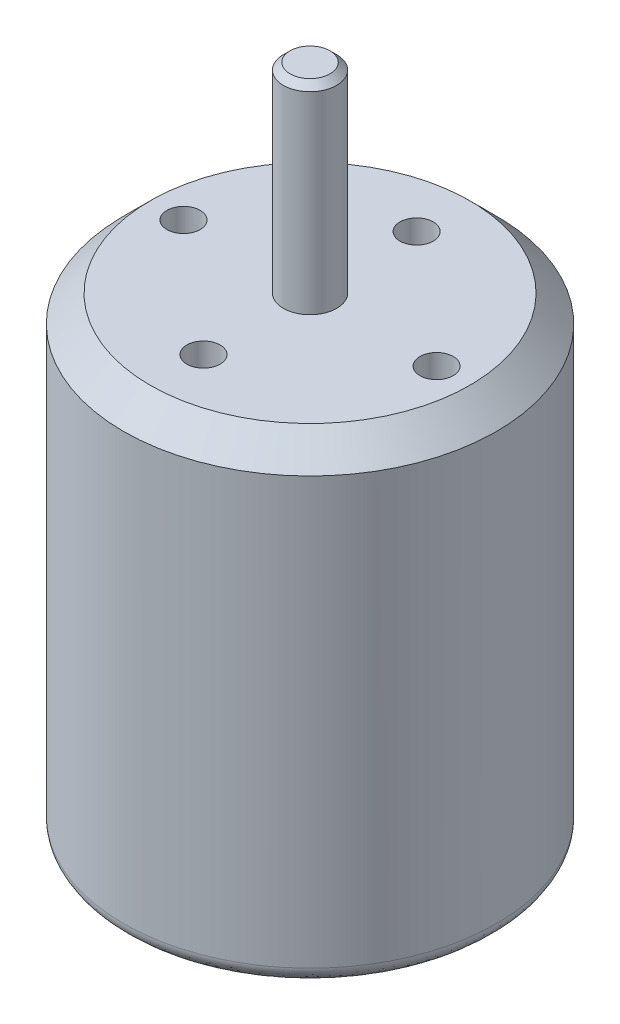
from build123d import *

# Parameters (mm, degrees)
SKETCH1_R                    = 14
BOSS_EXTRUDE1_DEPTH          = 36
SKETCH1_3_R                  = 2
BOSS_EXTRUDE2_DEPTH          = 15
BOSS_EXTRUDE3_START          = -38
SKETCH1_4_R                  = 2
BOSS_EXTRUDE3_DEPTH          = 2
CHAMFER1_SIZE                = 0.5
CHAMFER2_SIZE                = 2
FILLET1_SIZE                 = 2
FILLET1_SIZE_2               = 4
M3X0_5_TAPPED_HOLE2_D        = 2.5
M3X0_5_TAPPED_HOLE2_DEPTH    = 4
M3X0_5_TAPPED_HOLE2_TIP      = 0.751075774
M3X0_5_TAPPED_HOLE3_D        = 2.5
M3X0_5_TAPPED_HOLE3_DEPTH    = 4
M3X0_5_TAPPED_HOLE3_TIP      = 0.751075774
M2_5X0_45_TAPPED_HOLE1_D     = 2.05
M2_5X0_45_TAPPED_HOLE1_DEPTH = 4
M2_5X0_45_TAPPED_HOLE1_TIP   = 0.615882135


with BuildPart() as part:
    # Sketch1 → Boss-Extrude1 (new body)
    with BuildSketch(Plane(origin=(0, 0, 0), x_dir=(1, 0, 0), z_dir=(0, 1, 0))):
        with Locations(Location((0, 0, 0), (0, 0, 270))):
            Circle(SKETCH1_R)
    extrude(amount=-BOSS_EXTRUDE1_DEPTH)

    # Sketch1<3> → Boss-Extrude2 (add)
    with BuildSketch(Plane(origin=(0, 0, 0), x_dir=(1, 0, 0), z_dir=(0, 1, 0))):
        with Locations(Location((0, 0, 0), (0, 0, 270))):
            Circle(SKETCH1_3_R)
    extrude(amount=BOSS_EXTRUDE2_DEPTH)

    # Sketch1<4> → Boss-Extrude3 (add)
    with BuildSketch(Plane(origin=(0, 0, 0), x_dir=(1, 0, 0), z_dir=(0, 1, 0)).offset(BOSS_EXTRUDE3_START)):
        with Locations(Location((0, 0, 0), (0, 0, 270))):
            Circle(SKETCH1_4_R)
    extrude(amount=BOSS_EXTRUDE3_DEPTH)

    # Chamfer1
    chamfer1_edges = [part.edges().sort_by_distance(p)[0] for p in [
        (0, -38, -2),
        (0, 15, -2),
    ]]
    chamfer(chamfer1_edges, length=CHAMFER1_SIZE)

    # Chamfer2
    chamfer2_edges = [part.edges().sort_by_distance(p)[0] for p in [
        (0, 0, -14),
    ]]
    chamfer(chamfer2_edges, length=CHAMFER2_SIZE)

    # Fillet1
    # an asymmetric fillet: 4, 2 mm, written as the material it takes off along each edge
    with BuildSketch(Plane(origin=(0, -36, 0), x_dir=(0, 0, 1), z_dir=(-1, 0, 0))) as fillet1_piece_1:
        with BuildLine():
            Bezier((14, FILLET1_SIZE), (14, 0), (14 - FILLET1_SIZE_2, 0), weights=[1, 0.707106781, 1])
            Line((14 - FILLET1_SIZE_2, 0), (14, 0))
            Line((14, 0), (14, FILLET1_SIZE))
        make_face()
    revolve(axis=Axis((0, -36, 0), (0, 1, 0)), mode=Mode.SUBTRACT)

    # M3x0.5 Tapped Hole2
    with Locations(Plane(origin=(0, 0, 0), x_dir=(1, 0, 0), z_dir=(0, 1, 0))):
        with Locations((9.5, 0), (0, 8), (0, -8), (-9.5, 0)):
            Hole(M3X0_5_TAPPED_HOLE2_D / 2, depth=M3X0_5_TAPPED_HOLE2_DEPTH)
            with Locations((0, 0, -(M3X0_5_TAPPED_HOLE2_DEPTH + M3X0_5_TAPPED_HOLE2_TIP / 2))):  # 118° drill point
                Cone(0, M3X0_5_TAPPED_HOLE2_D / 2, M3X0_5_TAPPED_HOLE2_TIP, mode=Mode.SUBTRACT)

    # M3x0.5 Tapped Hole3
    with Locations(Plane.XZ.offset(36)):
        with Locations((6, 0), (-6, 0)):
            Hole(M3X0_5_TAPPED_HOLE3_D / 2, depth=M3X0_5_TAPPED_HOLE3_DEPTH)
            with Locations((0, 0, -(M3X0_5_TAPPED_HOLE3_DEPTH + M3X0_5_TAPPED_HOLE3_TIP / 2))):  # 118° drill point
                Cone(0, M3X0_5_TAPPED_HOLE3_D / 2, M3X0_5_TAPPED_HOLE3_TIP, mode=Mode.SUBTRACT)

    # M2.5x0.45 Tapped Hole1
    with Locations(Plane(origin=(0, -36, 0), x_dir=(-1, 0, 0), z_dir=(0, -1, 0))):
        with Locations((0, 6), (5.196152423, -3), (-5.196152423, -3)):
            Hole(M2_5X0_45_TAPPED_HOLE1_D / 2, depth=M2_5X0_45_TAPPED_HOLE1_DEPTH)
            with Locations((0, 0, -(M2_5X0_45_TAPPED_HOLE1_DEPTH + M2_5X0_45_TAPPED_HOLE1_TIP / 2))):  # 118° drill point
                Cone(0, M2_5X0_45_TAPPED_HOLE1_D / 2, M2_5X0_45_TAPPED_HOLE1_TIP, mode=Mode.SUBTRACT)


solid = part.part
